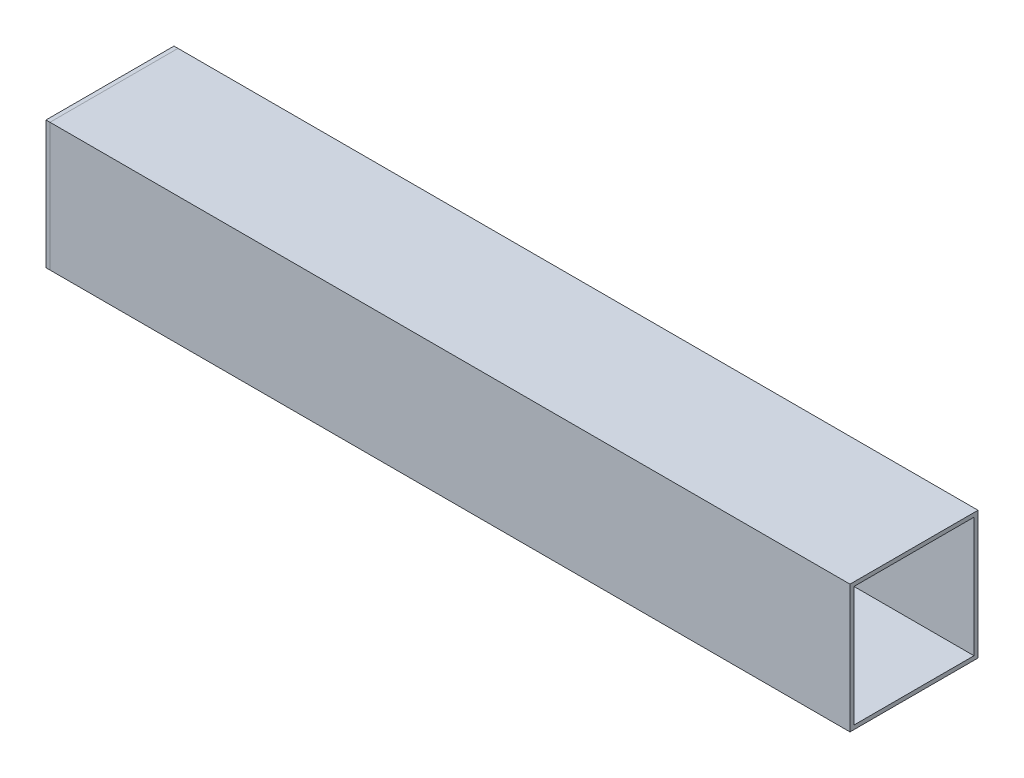
from build123d import *

# Parameters (mm, degrees)
SKETCH1_W           = 101.6
SKETCH1_H           = 101.6
SKETCH1_W_2         = 95.25
SKETCH1_H_2         = 95.25
BOSS_EXTRUDE1_DEPTH = 635
SKETCH2_W           = 101.6
SKETCH2_H           = 101.6
BOSS_EXTRUDE2_DEPTH = 3.175


with BuildPart() as part:
    # Sketch1 → Boss-Extrude1 (new body)
    with BuildSketch(Plane(origin=(0, 0, 0), x_dir=(0, 0, -1), z_dir=(1, 0, 0))):
        with Locations((-50.8, 50.8)):
            Rectangle(SKETCH1_W, SKETCH1_H)
        with Locations((-50.8, 50.8)):
            Rectangle(SKETCH1_W_2, SKETCH1_H_2, mode=Mode.SUBTRACT)
    extrude(amount=BOSS_EXTRUDE1_DEPTH)


with BuildPart() as body_2:
    # Sketch2 → Boss-Extrude2 (new body)
    with BuildSketch(Plane.ZY):
        with Locations((50.8, 50.8)):
            Rectangle(SKETCH2_W, SKETCH2_H)
    extrude(amount=BOSS_EXTRUDE2_DEPTH)


solid = Compound([part.part, body_2.part])
